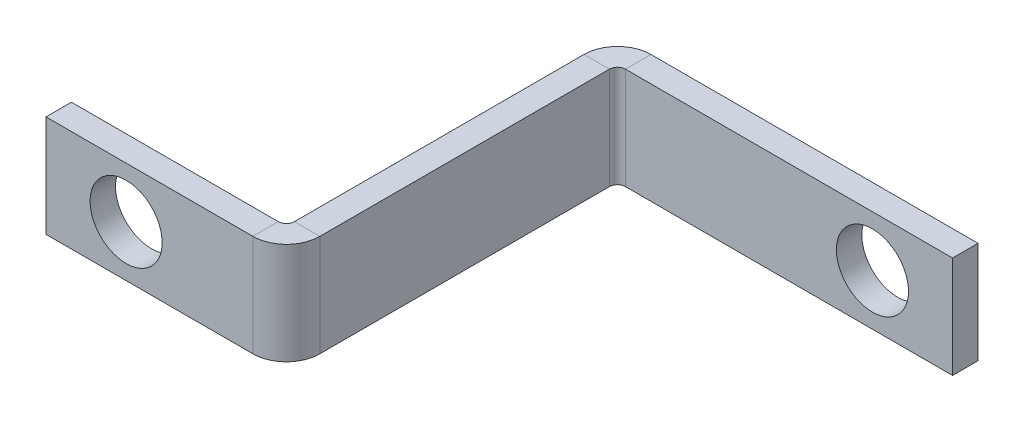
from build123d import *

# Parameters (mm, degrees)
SKETCH1_W                    = 30
SKETCH1_H                    = 12.7
BOSS_EXTRUDE1_DEPTH          = 3.175
EDGE_FLANGE1_STRIP_W         = 14.7
EDGE_FLANGE1_STRIP_H         = 3.175
EDGE_FLANGE1_STRIP_CUT_DEPTH = 12.7
EDGE_FLANGE1_DEPTH           = 12.7
EDGE_FLANGE2_STRIP_W         = 14.7
EDGE_FLANGE2_STRIP_H         = 3.175
EDGE_FLANGE2_STRIP_CUT_DEPTH = 12.7
EDGE_FLANGE2_DEPTH           = 12.7
M8_CLEARANCE_HOLE1_D         = 9


# Sheet-metal steps are written as plain solids
with BuildPart() as part:
    # Sketch1 → Boss-Extrude1 (new body)
    with BuildSketch(Plane.XY):
        with Locations((15, 6.35)):
            Rectangle(SKETCH1_W, SKETCH1_H)
    extrude(amount=BOSS_EXTRUDE1_DEPTH)

    # Edge-Flange1 strip (across the edge) → Edge-Flange1 strip cut (cut)
    with BuildSketch(Plane(origin=(30, 12.7, 0), x_dir=(-1, 0, 0), z_dir=(0, -1, 0))):
        with Locations((-3.175, -1.5875)):
            Rectangle(EDGE_FLANGE1_STRIP_W, EDGE_FLANGE1_STRIP_H)
    extrude(amount=EDGE_FLANGE1_STRIP_CUT_DEPTH, mode=Mode.SUBTRACT)

    # Edge-Flange1 section (across the edge) → Edge-Flange1 (add)
    with BuildSketch(Plane(origin=(30, 12.7, 0), x_dir=(-1, 0, 0), z_dir=(0, -1, 0))):
        with BuildLine():
            Line((0, 1), (0, 41.32))
            Line((0, 41.32), (3.175, 41.32))
            Line((3.175, 41.32), (3.175, 1))
            ThreePointArc((3.175, 1), (3.467893219, 0.292893219), (4.175, 0))
            Line((4.175, 0), (4.175, -3.175))
            ThreePointArc((4.175, -3.175), (1.222829189, -1.952170811), (0, 1))
        make_face()
    extrude(amount=EDGE_FLANGE1_DEPTH)

    # Edge-Flange2 strip (across the edge) → Edge-Flange2 strip cut (cut)
    with BuildSketch(Plane(origin=(30, 0, -41.32), x_dir=(0, 0, 1), z_dir=(0, 1, 0))):
        with Locations((-3.175, -1.5875)):
            Rectangle(EDGE_FLANGE2_STRIP_W, EDGE_FLANGE2_STRIP_H)
    extrude(amount=EDGE_FLANGE2_STRIP_CUT_DEPTH, mode=Mode.SUBTRACT)

    # Edge-Flange2 section (across the edge) → Edge-Flange2 (add)
    with BuildSketch(Plane(origin=(30, 0, -41.32), x_dir=(0, 0, 1), z_dir=(0, 1, 0))):
        with BuildLine():
            Line((0, 1), (0, 41.825))
            Line((0, 41.825), (3.175, 41.825))
            Line((3.175, 41.825), (3.175, 1))
            ThreePointArc((3.175, 1), (3.467893219, 0.292893219), (4.175, 0))
            Line((4.175, 0), (4.175, -3.175))
            ThreePointArc((4.175, -3.175), (1.222829189, -1.952170811), (0, 1))
        make_face()
    extrude(amount=EDGE_FLANGE2_DEPTH)

    # M8 Clearance Hole1 (through all)
    with Locations(Plane(origin=(0, 0, -41.32), x_dir=(-1, 0, 0), z_dir=(0, 0, -1))):
        with Locations((-61.825, 6.35), (-10, 6.35)):
            Hole(M8_CLEARANCE_HOLE1_D / 2)


solid = part.part
